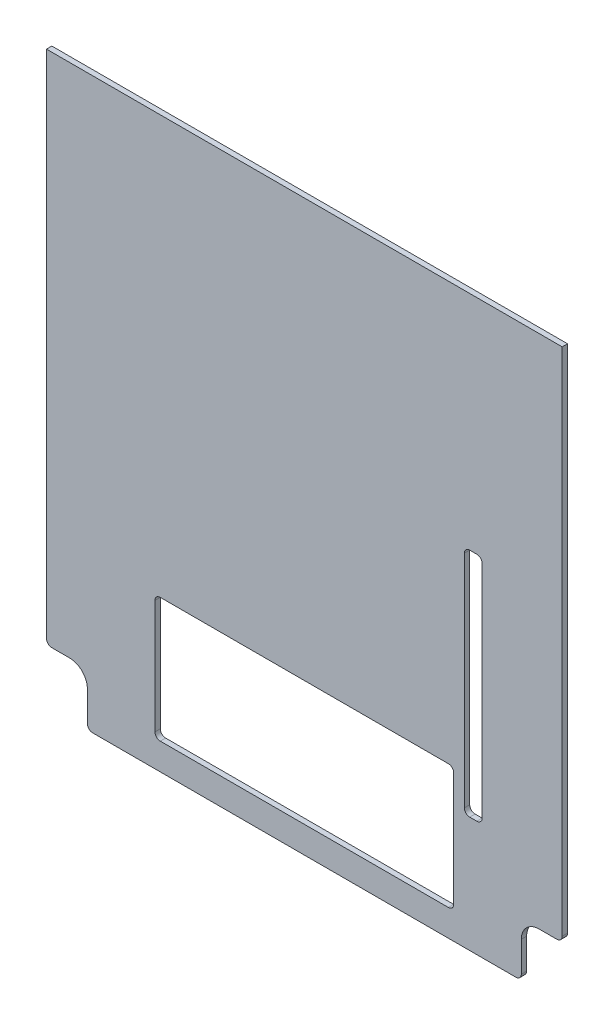
from build123d import *

# Parameters (mm, degrees)
ESQUISSE1_W                  = 290
ESQUISSE1_H                  = 320
BOSS_EXTRU_1_DEPTH           = 3
ENL_V_MAT_EXTRU_1_DEPTH      = 432.866877637
ENL_V_MAT_EXTRU_1_DEPTH_BACK = 432.866877637
ESQUISSE2_W                  = 23
ESQUISSE2_H                  = 30
CONG_1_R                     = 10
CONG_2_R                     = 3
ENL_V_MAT_EXTRU_2_DEPTH      = 432.866877637
ENL_V_MAT_EXTRU_2_DEPTH_BACK = 432.866877637
ESQUISSE3_W                  = 10
ESQUISSE3_H                  = 130
ENL_V_MAT_EXTRU_3_DEPTH      = 432.866877637
ENL_V_MAT_EXTRU_3_DEPTH_BACK = 432.866877637
ESQUISSE4_W                  = 168
ESQUISSE4_H                  = 70
CONG_3_R                     = 3


with BuildPart() as part:
    # Esquisse1 → Boss.-Extru.1 (new body)
    with BuildSketch(Plane.XY):
        with Locations((145, 160)):
            Rectangle(ESQUISSE1_W, ESQUISSE1_H)
    extrude(amount=BOSS_EXTRU_1_DEPTH)

    # Esquisse2 → Enlèv. mat.-Extru.1 (cut, two sides: drawn at the far end of the back side and taken through both)
    with BuildSketch(Plane.XY.offset(3).offset(-ENL_V_MAT_EXTRU_1_DEPTH_BACK)):
        with Locations((278.5, 15)):
            Rectangle(ESQUISSE2_W, ESQUISSE2_H)
        with Locations((11.5, 15)):
            Rectangle(ESQUISSE2_W, ESQUISSE2_H)
    extrude(amount=ENL_V_MAT_EXTRU_1_DEPTH + ENL_V_MAT_EXTRU_1_DEPTH_BACK, mode=Mode.SUBTRACT)

    # Congé1
    cong_1_edges = [part.edges().sort_by_distance(p)[0] for p in [
        (23, 30, 1.5),
        (267, 30, 1.5),
    ]]
    fillet(cong_1_edges, radius=CONG_1_R)

    # Congé2
    cong_2_edges = [part.edges().sort_by_distance(p)[0] for p in [
        (267, 0, 1.5),
        (290, 30, 1.5),
        (23, 0, 1.5),
        (0, 30, 1.5),
    ]]
    fillet(cong_2_edges, radius=CONG_2_R)

    # Esquisse3 → Enlèv. mat.-Extru.2 (cut, two sides: drawn at the far end of the back side and taken through both)
    with BuildSketch(Plane.XY.offset(3).offset(-ENL_V_MAT_EXTRU_2_DEPTH_BACK)):
        with Locations((240, 130)):
            Rectangle(ESQUISSE3_W, ESQUISSE3_H)
    extrude(amount=ENL_V_MAT_EXTRU_2_DEPTH + ENL_V_MAT_EXTRU_2_DEPTH_BACK, mode=Mode.SUBTRACT)

    # Esquisse4 → Enlèv. mat.-Extru.3 (cut, two sides: drawn at the far end of the back side and taken through both)
    with BuildSketch(Plane.XY.offset(3).offset(-ENL_V_MAT_EXTRU_3_DEPTH_BACK)):
        with Locations((145, 50)):
            Rectangle(ESQUISSE4_W, ESQUISSE4_H)
    extrude(amount=ENL_V_MAT_EXTRU_3_DEPTH + ENL_V_MAT_EXTRU_3_DEPTH_BACK, mode=Mode.SUBTRACT)

    # Congé3
    cong_3_edges = [part.edges().sort_by_distance(p)[0] for p in [
        (235, 195, 1.5),
        (245, 195, 1.5),
        (245, 65, 1.5),
        (235, 65, 1.5),
        (229, 15, 1.5),
        (229, 85, 1.5),
        (61, 85, 1.5),
        (61, 15, 1.5),
    ]]
    fillet(cong_3_edges, radius=CONG_3_R)


solid = part.part
